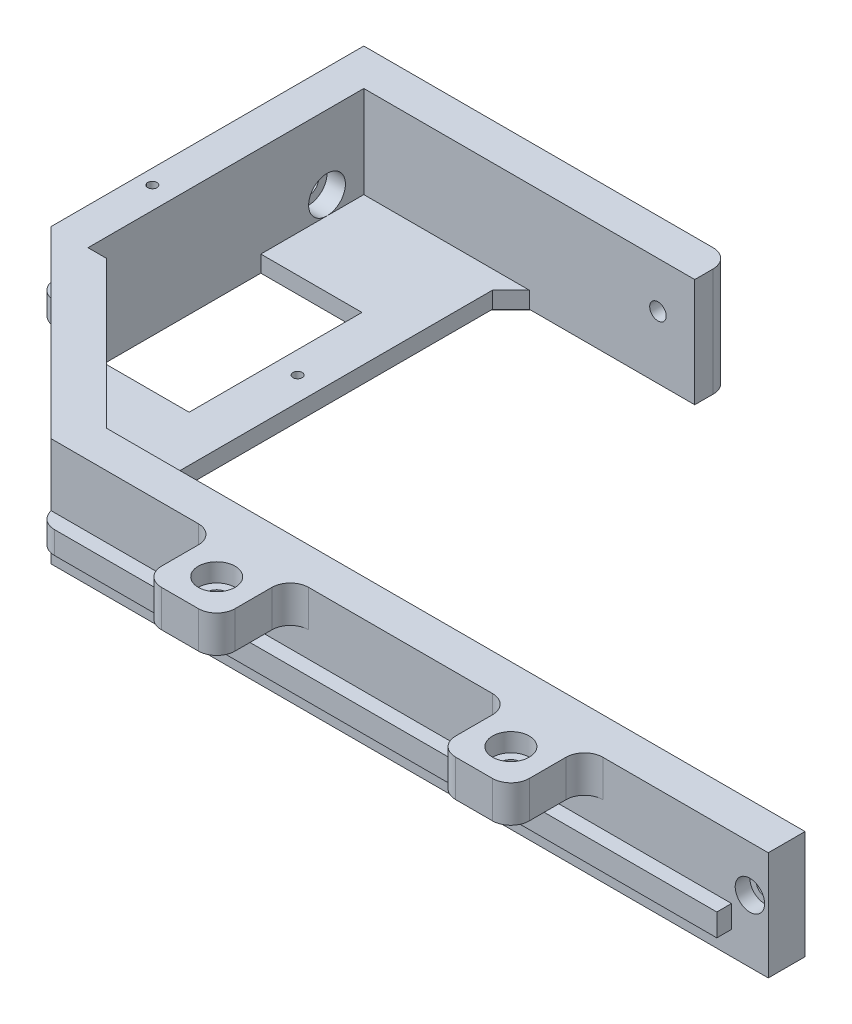
from build123d import *

# Parameters (mm, degrees)
BOSS_EXTRUDE1_DEPTH            = 30
CUT_EXTRUDE1_DEPTH             = 282.336097933
CHAMFER1_SIZE                  = 5
CBORE_FOR_M4_SHCS2_D           = 4.5
CBORE_FOR_M4_SHCS2_CBORE_D     = 8
CBORE_FOR_M4_SHCS2_CBORE_DEPTH = 4
CBORE_FOR_M4_SHCS1_D           = 4.5
CBORE_FOR_M4_SHCS1_CBORE_D     = 8
CBORE_FOR_M4_SHCS1_CBORE_DEPTH = 4
CUT_EXTRUDE2_DEPTH             = 25
SKETCH11_W                     = 27.5
SKETCH11_H                     = 47
CUT_EXTRUDE3_DEPTH             = 282.336097933
CBORE_FOR_M5_SHCS2_D           = 5.5
CBORE_FOR_M5_SHCS2_CBORE_D     = 10
CBORE_FOR_M5_SHCS2_CBORE_DEPTH = 5
M3X0_5_TAPPED_HOLE1_D          = 2.5
SKETCH21_W                     = 185
SKETCH21_H                     = 6.1
BOSS_EXTRUDE3_DEPTH            = 4
SKETCH22_W                     = 55
SKETCH22_H                     = 6.1
BOSS_EXTRUDE4_DEPTH            = 4
SKETCH23_W                     = 100
SKETCH23_H                     = 30
BOSS_EXTRUDE5_DEPTH            = 10
SKETCH24_W                     = 60
SKETCH24_H                     = 20
CUT_EXTRUDE4_DEPTH             = 10
CBORE_FOR_M5_SHCS3_D           = 5.5
CBORE_FOR_M5_SHCS3_CBORE_D     = 10
CBORE_FOR_M5_SHCS3_CBORE_DEPTH = 5
FILLET1_R                      = 5
CHAMFER2_SIZE                  = 0.5


with BuildPart() as part:
    # Sketch1 → Boss-Extrude1 (new body)
    with BuildSketch(Plane(origin=(0, 0, 0), x_dir=(1, 0, 0), z_dir=(0, 1, 0))):
        Polygon((245, 10), (50, 10), (50, 125), (100, 125), (100, 135), (0, 135), (0, 0), (245, 0), align=None)
    extrude(amount=BOSS_EXTRUDE1_DEPTH)

    # Sketch3 → Cut-Extrude1 (cut, through all)
    with BuildSketch(Plane.XZ):
        Polygon((50, 0), (0, -50), (0, 0), align=None)
    extrude(amount=-CUT_EXTRUDE1_DEPTH, mode=Mode.SUBTRACT)

    # Chamfer1
    chamfer1_edges = [part.edges().sort_by_distance(p)[0] for p in [
        (50, 15, -125),
        (50, 15, -10),
    ]]
    chamfer(chamfer1_edges, length=CHAMFER1_SIZE)

    # CBORE for M4 SHCS2 (through all)
    with Locations(Plane.XY):
        with Locations((240, 17.5), (90, 17.5)):
            CounterBoreHole(CBORE_FOR_M4_SHCS2_D / 2, CBORE_FOR_M4_SHCS2_CBORE_D / 2, CBORE_FOR_M4_SHCS2_CBORE_DEPTH)

    # CBORE for M4 SHCS1 (through all)
    with Locations(Plane(origin=(0, 0, -135), x_dir=(-1, 0, 0), z_dir=(0, 0, -1))):
        with Locations((-90, 17.5)):
            CounterBoreHole(CBORE_FOR_M4_SHCS1_D / 2, CBORE_FOR_M4_SHCS1_CBORE_D / 2, CBORE_FOR_M4_SHCS1_CBORE_DEPTH)

    # Sketch10 → Cut-Extrude2 (cut)
    with BuildSketch(Plane(origin=(0, 30, 0), x_dir=(1, 0, 0), z_dir=(0, 1, 0))):
        Polygon((55, 125), (10, 125), (10, 55), (50, 15), align=None)
    extrude(amount=-CUT_EXTRUDE2_DEPTH, mode=Mode.SUBTRACT)

    # Sketch11 → Cut-Extrude3 (cut, through all)
    with BuildSketch(Plane(origin=(0, 30, 0), x_dir=(1, 0, 0), z_dir=(0, 1, 0))):
        with Locations((23.75, 73.5)):
            Rectangle(SKETCH11_W, SKETCH11_H)
    extrude(amount=-CUT_EXTRUDE3_DEPTH, mode=Mode.SUBTRACT)

    # CBORE for M5 SHCS2 (through all)
    with Locations(Plane(origin=(10, 0, 0), x_dir=(0, 0, -1), z_dir=(1, 0, 0))):
        with Locations((115, 10)):
            CounterBoreHole(CBORE_FOR_M5_SHCS2_D / 2, CBORE_FOR_M5_SHCS2_CBORE_D / 2, CBORE_FOR_M5_SHCS2_CBORE_DEPTH)

    # M3x0.5 Tapped Hole1 (through all)
    with Locations(Plane(origin=(0, 0, 0), x_dir=(-1, 0, 0), z_dir=(0, -1, 0))):
        with Locations((-4, 73.5), (-43.5, 73.5)):
            Hole(M3X0_5_TAPPED_HOLE1_D / 2)

    # Sketch21 → Boss-Extrude3 (add)
    with BuildSketch(Plane.XY):
        with Locations((142.5, 10)):
            Rectangle(SKETCH21_W, SKETCH21_H)
    extrude(amount=BOSS_EXTRUDE3_DEPTH)

    # Sketch22 → Boss-Extrude4 (add)
    with BuildSketch(Plane.ZY):
        with Locations((-77.5, 10)):
            Rectangle(SKETCH22_W, SKETCH22_H)
    extrude(amount=BOSS_EXTRUDE4_DEPTH)

    # Sketch23 → Boss-Extrude5 (add)
    with BuildSketch(Plane(origin=(0, 30, 0), x_dir=(1, 0, 0), z_dir=(0, 1, 0))):
        with Locations((145, -5)):
            Rectangle(SKETCH23_W, SKETCH23_H)
    extrude(amount=-BOSS_EXTRUDE5_DEPTH)

    # Sketch24 → Cut-Extrude4 (cut)
    with BuildSketch(Plane.XZ.offset(-20)):
        with Locations((145, 10)):
            Rectangle(SKETCH24_W, SKETCH24_H)
    extrude(amount=-CUT_EXTRUDE4_DEPTH, mode=Mode.SUBTRACT)

    # CBORE for M5 SHCS3 (through all)
    with Locations(Plane(origin=(0, 30, 0), x_dir=(1, 0, 0), z_dir=(0, 1, 0))):
        with Locations((105, -10), (185, -10)):
            CounterBoreHole(CBORE_FOR_M5_SHCS3_D / 2, CBORE_FOR_M5_SHCS3_CBORE_D / 2, CBORE_FOR_M5_SHCS3_CBORE_DEPTH)

    # Fillet1
    # the kernel refuses this fillet: 5 mm, written as the material it adds along each edge
    with BuildSketch(Plane(origin=(195, 20, 0), x_dir=(1, 0, 0), z_dir=(0, 1, 0)), Plane(origin=(115, 20, 0), x_dir=(1, 0, 0), z_dir=(0, 1, 0))) as fillet1_piece_1:
        with BuildLine():
            CenterArc((FILLET1_R, -FILLET1_R), FILLET1_R, 90, 90)
            Line((0, -FILLET1_R), (0, 0))
            Line((0, 0), (FILLET1_R, 0))
        make_face()
    extrude(amount=10)
    with BuildSketch(Plane(origin=(175, 20, 0), x_dir=(-1, 0, 0), z_dir=(0, 1, 0))) as fillet1_piece_2:
        with BuildLine():
            CenterArc((FILLET1_R, FILLET1_R), FILLET1_R, 180, 90)
            Line((0, FILLET1_R), (0, 0))
            Line((0, 0), (FILLET1_R, 0))
        make_face()
    extrude(amount=10)
    with BuildSketch(Plane(origin=(95, 30, 0), x_dir=(-1, 0, 0), z_dir=(0, -1, 0))) as fillet1_piece_3_section:
        with BuildLine():
            CenterArc((FILLET1_R, -FILLET1_R), FILLET1_R, 90, 90)
            Line((0, -FILLET1_R), (0, 0))
            Line((0, 0), (FILLET1_R, 0))
        make_face()
    fillet1_piece_3 = extrude(amount=10, mode=Mode.PRIVATE)
    fillet1_piece_3 = fillet1_piece_3 - Plane(origin=(90, 17.5, 0), x_dir=(1, 0, 0), z_dir=(0, 0, 1)) * Cylinder(4, 40, mode=Mode.PRIVATE)
    add(fillet1_piece_3)
    # the kernel refuses this fillet: 5 mm, written as the material it takes off along each edge
    with BuildSketch(Plane(origin=(-4, -5.297448714, -105), x_dir=(0, 0, 1), z_dir=(0, 1, 0)), Plane(origin=(50, -5.297448714, 4), x_dir=(1, 0, 0), z_dir=(0, 1, 0))) as fillet1_2_piece_1:
        with BuildLine():
            CenterArc((4.898979486, 5), FILLET1_R, 191.536959033, 78.463040967)
            Line((0, 4), (0, 0))
            Line((0, 0), (4.898979486, 0))
        make_face()
    extrude(amount=30.594897428, mode=Mode.SUBTRACT)
    with BuildSketch(Plane(origin=(-4, 25.297448714, -50), x_dir=(1.0, 0, -1.5791812302263136e-12), z_dir=(0, -1, 0))) as fillet1_2_piece_2:
        with BuildLine():
            CenterArc((5, -4.898979486), FILLET1_R, 101.536959033, 78.463040967)
            Line((0, -4.898979486), (0, 0))
            Line((0, 0), (4, 0))
        make_face()
    extrude(amount=30.594897428, mode=Mode.SUBTRACT)
    with BuildSketch(Plane(origin=(195, 42.5, 20), x_dir=(0, 0, -1), z_dir=(0, -1, 0)), Plane(origin=(95, 42.5, 20), x_dir=(1, 0, 0), z_dir=(0, -1, 0))) as fillet1_2_piece_3:
        with BuildLine():
            CenterArc((FILLET1_R, -FILLET1_R), FILLET1_R, 90, 90)
            Line((0, -FILLET1_R), (0, 0))
            Line((0, 0), (FILLET1_R, 0))
        make_face()
    extrude(amount=35, mode=Mode.SUBTRACT)
    with BuildSketch(Plane(origin=(175, 7.5, 20), x_dir=(1, 0, 0), z_dir=(0, 1, 0)), Plane(origin=(115, 7.5, 20), x_dir=(0, 0, -1), z_dir=(0, 1, 0))) as fillet1_2_piece_4:
        with BuildLine():
            CenterArc((FILLET1_R, FILLET1_R), FILLET1_R, 180, 90)
            Line((0, FILLET1_R), (0, 0))
            Line((0, 0), (FILLET1_R, 0))
        make_face()
    extrude(amount=35, mode=Mode.SUBTRACT)
    with BuildSketch(Plane(origin=(100, -12.5, -135), x_dir=(0, 0, 1), z_dir=(0, 1, 0))) as fillet1_2_piece_5:
        with BuildLine():
            CenterArc((FILLET1_R, -FILLET1_R), FILLET1_R, 90, 90)
            Line((0, -FILLET1_R), (0, 0))
            Line((0, 0), (FILLET1_R, 0))
        make_face()
    extrude(amount=55, mode=Mode.SUBTRACT)

    # Chamfer2
    chamfer2_edges = [part.edges().sort_by_distance(p)[0] for p in [
        (150, 0, -10),
        (10, 0, -73.5),
        (37.5, 0, -73.5),
        (23.75, 0, -50),
        (23.75, 0, -97),
        (245, 0, -5),
        (0, 0, -92.5),
        (42.25, 0, -73.5),
        (2.75, 0, -73.5),
        (47.5, 0, -135),
        (98.535533906, 0, -133.535533906),
        (147.5, 0, 0),
        (25, 0, -25),
        (77.5, 0, -125),
        (50, 0, -67.5),
        (52.5, 0, -122.5),
        (52.5, 0, -12.5),
        (100, 0, -127.5),
    ]]
    chamfer(chamfer2_edges, length=CHAMFER2_SIZE)


solid = part.part
